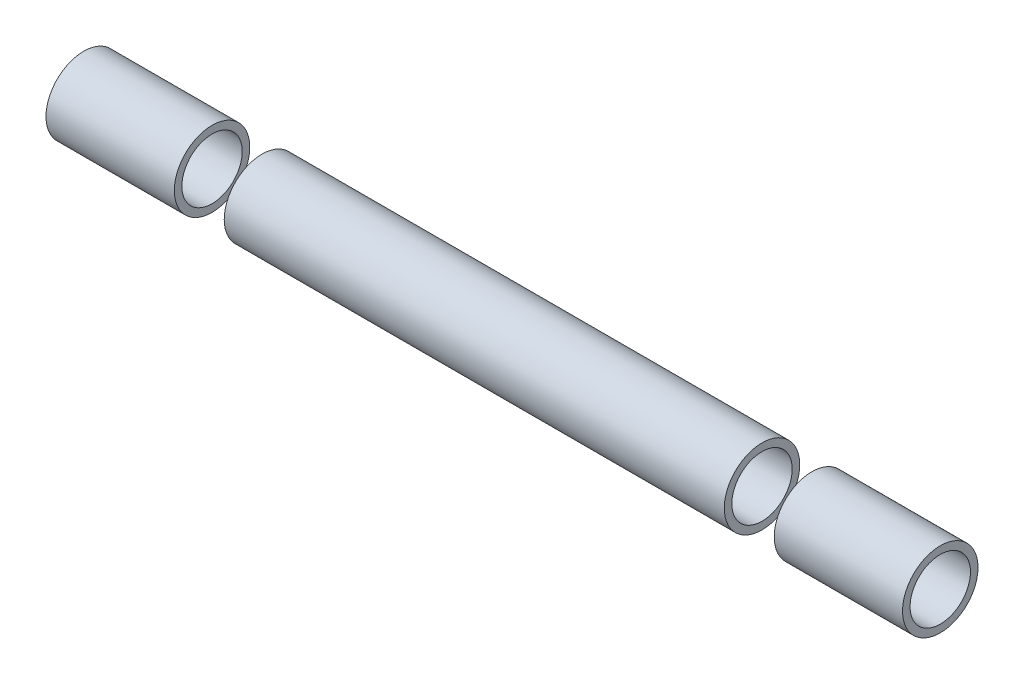
from build123d import *

# Parameters (mm, degrees)
SKETCH1_R               = 15.875
SKETCH1_R_2             = 12.7
EXTRUDE_THIN1_DEPTH     = 180.1495
CUT_EXTRUDE1_DEPTH      = 182.543035119
CUT_EXTRUDE1_DEPTH_BACK = 182.543035119
SKETCH2_W               = 20.99999991
SKETCH2_H               = 31.75


with BuildPart() as part:
    # Sketch1 → Extrude-Thin1 (new, symmetric)
    with BuildSketch(Plane(origin=(0, 0, 0), x_dir=(0, 0, -1), z_dir=(1, 0, 0))):
        Circle(SKETCH1_R)
        Circle(SKETCH1_R_2, mode=Mode.SUBTRACT)
    extrude(amount=EXTRUDE_THIN1_DEPTH, both=True)

    # Sketch2 → Cut-Extrude1 (cut, two sides: drawn at the far end of the back side and taken through both)
    with BuildSketch(Plane.XY.offset(-CUT_EXTRUDE1_DEPTH_BACK)):
        with Locations((115.674500045, 0)):
            Rectangle(SKETCH2_W, SKETCH2_H)
        with Locations((-115.674500045, 0)):
            Rectangle(SKETCH2_W, SKETCH2_H)
    extrude(amount=CUT_EXTRUDE1_DEPTH + CUT_EXTRUDE1_DEPTH_BACK, mode=Mode.SUBTRACT)


with BuildPart() as cut_extrude1_piece_1:
    # of the separate pieces the step leaves, piece 1, a body of its own (cut_extrude1_pieces)
    add(part.part.solids().sort_by_distance((-105.17450009, 0, -15.875))[0])


with BuildPart() as cut_extrude1_piece_2:
    # of the separate pieces the step leaves, piece 2, a body of its own (cut_extrude1_pieces)
    add(part.part.solids().sort_by_distance((126.1745, 0, -15.875))[0])


with BuildPart() as cut_extrude1_piece_3:
    # of the separate pieces the step leaves, piece 3, a body of its own (cut_extrude1_pieces)
    add(part.part.solids().sort_by_distance((-180.1495, 0, -15.875))[0])


solid = Compound([cut_extrude1_piece_1.part, cut_extrude1_piece_2.part, cut_extrude1_piece_3.part])
